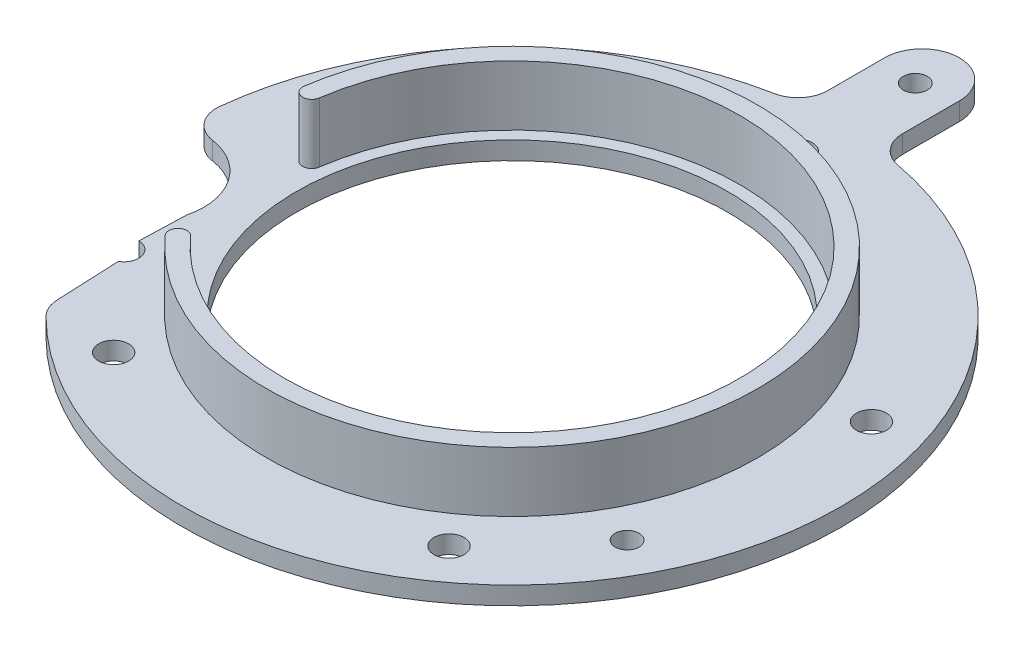
from build123d import *

# Parameters (mm, degrees)
SKETCH4_R           = 36
BOSS_EXTRUDE1_DEPTH = 3
SKETCH5_R           = 2
SKETCH5_R_2         = 2.5
CUT_EXTRUDE1_DEPTH  = 93.694705096
CUT_EXTRUDE2_DEPTH  = 93.694705096
FILLET1_R           = 5
FILLET2_RADIUS      = 6.234464512
FILLET2_LENGTH      = 3
BOSS_EXTRUDE2_DEPTH = 10
FILLET4_START       = 3
FILLET4_DEPTH       = 11
FILLET5_START       = 3
FILLET5_DEPTH       = 11


with BuildPart() as part:
    # Sketch4 → Boss-Extrude1 (new body)
    with BuildSketch(Plane(origin=(0, 0, 0), x_dir=(1, 0, 0), z_dir=(0, 1, 0))):
        with BuildLine():
            Line((3.272204442, 66.499609121), (15.741133466, 66.499609121))
            Line((15.741133466, 66.499609121), (15.741133466, 46.499609121))
            ThreePointArc((15.741133466, 46.499609121), (9.506668954, -63.145898034), (3.272204442, 46.499609121))
            Line((3.272204442, 46.499609121), (3.272204442, 66.499609121))
        make_face()
        with Locations(Location((9.506668954, -8.145898034, 0), (0, 0, 270))):
            Circle(SKETCH4_R, mode=Mode.SUBTRACT)
    extrude(amount=BOSS_EXTRUDE1_DEPTH)

    # Sketch5 → Cut-Extrude1 (cut, through all)
    with BuildSketch(Plane(origin=(0, 3, 0), x_dir=(1, 0, 0), z_dir=(0, 1, 0))):
        with Locations(Location((9.506668954, 59.145898034, 0), (0, 0, 270))):
            Circle(SKETCH5_R)
        with Locations(Location((9.506668954, 39.454101966, 0), (0, 0, 270))):
            Circle(SKETCH5_R_2)
        with Locations(Location((54.77695913, 6.563310898, 0), (0, 0, 270))):
            Circle(SKETCH5_R_2)
        with Locations(Location((51.506668954, -30.947448364, 0), (0, 0, 270))):
            Circle(SKETCH5_R)
        with Locations(Location((37.485246963, -46.655106966, 0), (0, 0, 270))):
            Circle(SKETCH5_R_2)
        with Locations(Location((-18.471909055, -46.655106966, 0), (0, 0, 270))):
            Circle(SKETCH5_R_2)
        with Locations(Location((-32.493331046, -30.947448364, 0), (0, 0, 270))):
            Circle(SKETCH5_R_2)
        with Locations(Location((-33.116843335, 13.043632404, 0), (0, 0, 270))):
            Circle(SKETCH5_R_2)
    extrude(amount=-CUT_EXTRUDE1_DEPTH, mode=Mode.SUBTRACT)

    # Sketch6 → Cut-Extrude2 (cut, through all)
    with BuildSketch(Plane(origin=(0, 3, 0), x_dir=(1, 0, 0), z_dir=(0, 1, 0))):
        with BuildLine():
            Line((-31.240982332, -33.111154143), (-30.281144407, -54.888863669))
            Line((-30.281144407, -54.888863669), (-55.634525549, -56.00629692))
            Line((-55.634525549, -56.00629692), (-56.656818195, -8.246358342))
            Line((-56.656818195, -8.246358342), (-42.942031477, -7.625931476))
            ThreePointArc((-42.942031477, -7.625931476), (-34.312049589, -11.478197503), (-32.241689114, -20.699376843))
            Line((-32.241689114, -20.699376843), (-32.493331046, -28.447448364))
            ThreePointArc((-32.493331046, -28.447448364), (-30.078867912, -30.299090611), (-31.240982332, -33.111154143))
        make_face()
    extrude(amount=-CUT_EXTRUDE2_DEPTH, mode=Mode.SUBTRACT)

    # Fillet1
    fillet1_edges = [part.edges().sort_by_distance(p)[0] for p in [
        (3.272204442, 1.5, -46.499609121),
        (15.741133466, 1.5, -46.499609121),
        (-30.686613079, 1.5, 45.689207416),
        (-45.491842696, 1.5, 7.741279342),
    ]]
    fillet(fillet1_edges, radius=FILLET1_R)

    # Fillet2: full round fillet: the end face becomes a half cylinder, R = half its width
    fillet2_face = Plane((9.506668954, 1.5, -66.499609121), x_dir=(0, 1, 0), z_dir=(0, 0, -1))  # on the end face: x along it, z out of the body
    fillet2_slab = fillet2_face.offset(-FILLET2_RADIUS / 2) * Box(FILLET2_LENGTH, 2 * FILLET2_RADIUS, FILLET2_RADIUS, mode=Mode.PRIVATE)  # the body's end, R deep
    fillet2_round = Plane((9.506668954, 1.5, -60.265144609), x_dir=(0, 0, -1), z_dir=(0, 1, 0)) * Cylinder(FILLET2_RADIUS, FILLET2_LENGTH, mode=Mode.PRIVATE)  # its axis R under the face
    add(fillet2_slab - fillet2_round, mode=Mode.SUBTRACT)

    # Sketch9 → Boss-Extrude2 (add)
    with BuildSketch(Plane(origin=(0, 3, 0), x_dir=(1, 0, 0), z_dir=(0, 1, 0))):
        with BuildLine():
            Line((-31.282982054, -3.998082872), (-28.266279427, -3.998082872))
            ThreePointArc((-28.266279427, -3.998082872), (46.288733159, 1.397673249), (-21.484606715, -30.135459931))
            Line((-21.484606715, -30.135459931), (-21.484606715, -34.988789689))
            ThreePointArc((-21.484606715, -34.988789689), (48.599268457, 4.214064106), (-31.282982054, -3.998082872))
        make_face()
    extrude(amount=BOSS_EXTRUDE2_DEPTH)

    # Fillet4: read off the stored shape, not the designer's step
    # Fillet4 outline → Fillet4 (cut)
    with BuildSketch(Plane(origin=(0, 0, 0), x_dir=(1, 0, 0), z_dir=(0, 1, 0)).offset(FILLET4_START)):
        with BuildLine():
            ThreePointArc((-21.484606715, -34.988789689), (-21.295327251, -35.205776633), (-21.104528575, -35.421428933))
            add(Edge.make_bspline(
                [(-21.104528575, -35.421428933), (-21.228279098, -35.282544315), (-21.3411007, -35.112745613), (-21.431423393, -34.910535387), (-21.484606706, -34.678162347), (-21.484606715, -34.423543707)],
                knots=[0, 0, 0, 0, 0, 0, 0.275825991, 0.275825991, 0.275825991, 0.275825991, 0.275825991, 0.275825991], degree=5, weights=[1, 0.889669603, 0.794555202, 0.714656797, 0.649974387, 0.600507972]))
            Line((-21.484606715, -34.423543707), (-21.484606715, -34.988789689))
        make_face()
        with BuildLine():
            Line((-21.484606715, -30.135459931), (-21.484606715, -34.423543707))
            add(Edge.make_bspline(
                [(-21.484606715, -34.423543707), (-21.484606746, -33.500313944), (-20.896716335, -32.737133887), (-19.98906503, -32.613765882), (-19.271618069, -32.968959182), (-18.864684854, -33.425658379)],
                knots=[0.275825991, 0.275825991, 0.275825991, 0.275825991, 0.275825991, 0.275825991, 1, 1, 1, 1, 1, 1], degree=5, weights=[0.600507972, 0.47063518, 0.445647986, 0.525546392, 0.710330397, 1]))
            ThreePointArc((-18.864684854, -33.425658379), (-20.22020098, -31.816833883), (-21.484606715, -30.135459931))
        make_face()
    extrude(amount=FILLET4_DEPTH, mode=Mode.SUBTRACT)

    # Fillet5: read off the stored shape, not the designer's step
    # Fillet5 outline → Fillet5 (cut)
    with BuildSketch(Plane(origin=(0, 0, 0), x_dir=(1, 0, 0), z_dir=(0, 1, 0)).offset(FILLET5_START)):
        with BuildLine():
            ThreePointArc((-28.266279427, -3.998082872), (-28.19006415, -3.354623327), (-28.102888392, -2.712556866))
            add(Edge.make_bspline(
                [(-28.102888392, -2.712556866), (-28.151775573, -3.050953664), (-28.302840716, -3.42403045), (-28.598328595, -3.773471224), (-29.047777864, -3.998082872), (-29.587476182, -3.998082872)],
                knots=[0, 0, 0, 0, 0, 0, 0.464069746, 0.464069746, 0.464069746, 0.464069746, 0.464069746, 0.464069746], degree=5, weights=[1, 0.814372102, 0.671816349, 0.572332742, 0.515921281, 0.502581966]))
            Line((-29.587476182, -3.998082872), (-28.266279427, -3.998082872))
        make_face()
        with BuildLine():
            Line((-31.282982054, -3.998082872), (-29.587476182, -3.998082872))
            add(Edge.make_bspline(
                [(-29.587476182, -3.998082872), (-30.247519863, -3.998082872), (-30.77941952, -3.674118257), (-31.063082194, -3.179978591), (-31.130586894, -2.688704223), (-31.072063972, -2.283608879)],
                knots=[0.464069746, 0.464069746, 0.464069746, 0.464069746, 0.464069746, 0.464069746, 1, 1, 1, 1, 1, 1], degree=5, weights=[0.502581966, 0.487177078, 0.529216438, 0.628700044, 0.785627898, 1]))
            ThreePointArc((-31.072063972, -2.283608879), (-31.186553224, -3.13973496), (-31.282982054, -3.998082872))
        make_face()
    extrude(amount=FILLET5_DEPTH, mode=Mode.SUBTRACT)


solid = part.part
